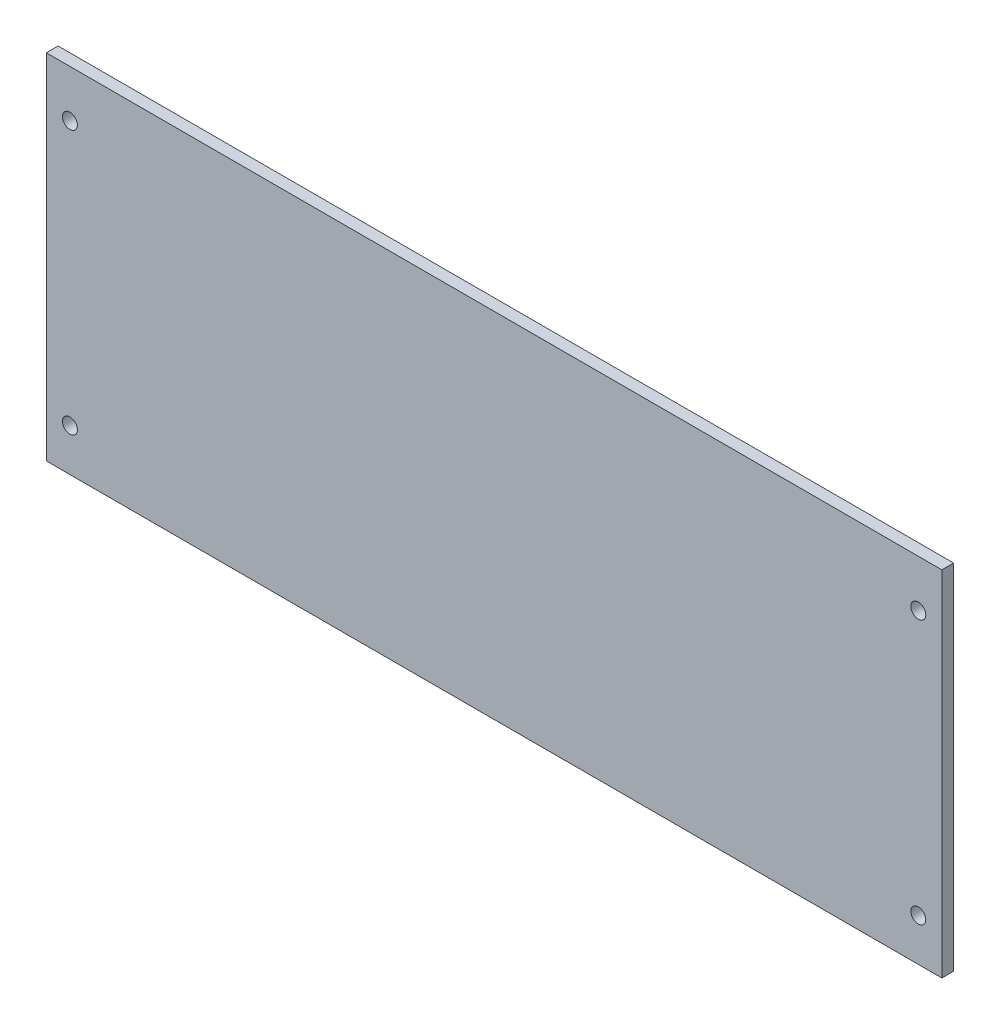
from build123d import *

# Parameters (mm, degrees)
SKETCH1_W           = 190
SKETCH1_H           = 75
SKETCH1_R           = 1.585
BOSS_EXTRUDE1_DEPTH = 2.5


with BuildPart() as part:
    # Sketch1 → Boss-Extrude1 (new body)
    with BuildSketch(Plane.XY):
        with Locations((95, 37.5)):
            Rectangle(SKETCH1_W, SKETCH1_H)
        with Locations((5, 65)):
            Circle(SKETCH1_R, mode=Mode.SUBTRACT)
        with Locations((185, 65)):
            Circle(SKETCH1_R, mode=Mode.SUBTRACT)
        with Locations((5, 9)):
            Circle(SKETCH1_R, mode=Mode.SUBTRACT)
        with Locations((185, 9)):
            Circle(SKETCH1_R, mode=Mode.SUBTRACT)
    extrude(amount=BOSS_EXTRUDE1_DEPTH)


solid = part.part
